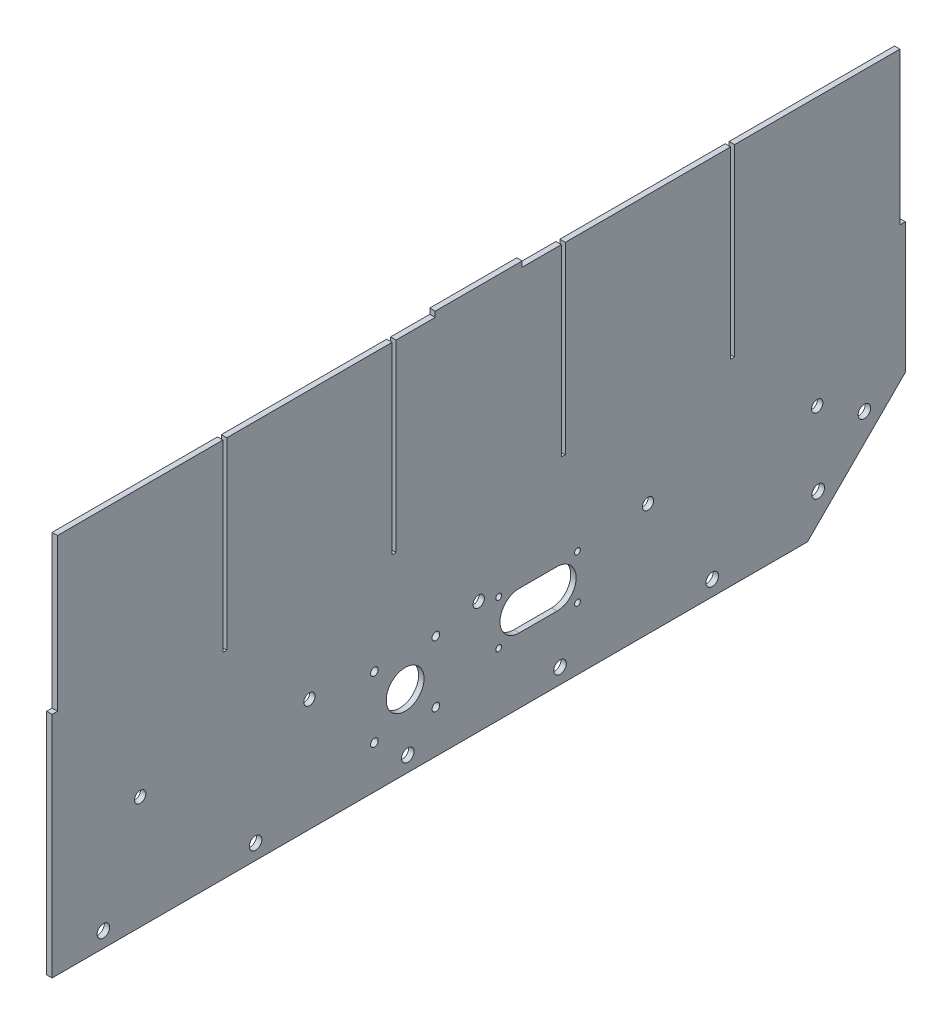
from build123d import *

# Parameters (mm, degrees)
SKETCH1_W            = 498.348
SKETCH1_H            = 165.1
BOSS_EXTRUDE1_DEPTH  = 1.5875
BOSS_EXTRUDE2_DEPTH  = 3.175
SKETCH3_R            = 3.675
CUT_EXTRUDE1_DEPTH   = 286.681383539
LPATTERN1_COUNT      = 5
LPATTERN1_PITCH      = 88.9
SKETCH4_R            = 3.675
CUT_EXTRUDE2_DEPTH   = 286.681383539
LPATTERN2_COUNT      = 2
LPATTERN2_PITCH      = 38.1
SKETCH5_W            = 3.175
SKETCH5_H            = 88.9
CUT_EXTRUDE3_DEPTH   = 286.681383539
SKETCH6_W            = 2.286
SKETCH6_H            = 107.442
CUT_EXTRUDE4_DEPTH   = 286.681383539
LPATTERN3_COUNT      = 4
LPATTERN3_PITCH      = 98.8568
SKETCH8_W            = 50.8
SKETCH8_H            = 3.175
BOSS_EXTRUDE3_DEPTH  = 3.175
SKETCH9_R            = 11.05
CUT_EXTRUDE5_DEPTH   = 286.681383539
M6_CLEARANCE_HOLE1_D = 6.6
LPATTERN4_COUNT      = 3
LPATTERN4_PITCH      = 98.8568
LPATTERN4_COUNT_DIR2 = 3
LPATTERN4_PITCH_DIR2 = 98.8568
M3_CLEARANCE_HOLE1_D = 3.4
M4_CLEARANCE_HOLE1_D = 4.5
CUT_EXTRUDE6_DEPTH   = 286.681383539


with BuildPart() as part:
    # Sketch1 → Boss-Extrude1 (new, symmetric)
    with BuildSketch(Plane(origin=(0, 0, 0), x_dir=(0, 0, -1), z_dir=(1, 0, 0))):
        Rectangle(SKETCH1_W, SKETCH1_H)
    extrude(amount=BOSS_EXTRUDE1_DEPTH, both=True)

    # Sketch2 → Boss-Extrude2 (add)
    with BuildSketch(Plane(origin=(1.5875, 0, 0), x_dir=(0, 0, -1), z_dir=(1, 0, 0))):
        Polygon((192.024, -139.7), (249.174, -82.55), (-249.174, -82.55), (-249.174, -139.7), align=None)
    extrude(amount=-BOSS_EXTRUDE2_DEPTH)

    # Sketch3 → Cut-Extrude1 (cut, through all)
    with BuildSketch(Plane.ZY.offset(1.5875)):
        with Locations((219.202, -130.81)):
            Circle(SKETCH3_R)
    cut_extrude1 = extrude(amount=-CUT_EXTRUDE1_DEPTH, mode=Mode.SUBTRACT)

    # LPattern1: Cut-Extrude1 ×5
    with Locations(*[(0, 0, -i * LPATTERN1_PITCH) for i in range(1, LPATTERN1_COUNT)]):
        add(cut_extrude1, mode=Mode.SUBTRACT)

    # Sketch4 → Cut-Extrude2 (cut, symmetric)
    with BuildSketch(Plane.ZY.offset(1.5875)):
        with Locations((-198.310179285, -117.249359697)):
            Circle(SKETCH4_R)
    cut_extrude2 = extrude(amount=CUT_EXTRUDE2_DEPTH, both=True, mode=Mode.SUBTRACT)

    # LPattern2: Cut-Extrude2 ×2
    with Locations(*[Vector(0, 0.7071067811865439, -0.7071067811865512) * (i * LPATTERN2_PITCH) for i in range(1, LPATTERN2_COUNT)]):
        add(cut_extrude2, mode=Mode.SUBTRACT)

    # Sketch5 → Cut-Extrude3 (cut, through all)
    with BuildSketch(Plane(origin=(1.5875, 0, 0), x_dir=(0, 0, -1), z_dir=(1, 0, 0))):
        with Locations((247.5865, 38.1)):
            Rectangle(SKETCH5_W, SKETCH5_H)
        with Locations((-247.5865, 38.1)):
            Rectangle(SKETCH5_W, SKETCH5_H)
    extrude(amount=-CUT_EXTRUDE3_DEPTH, mode=Mode.SUBTRACT)

    # Sketch6 → Cut-Extrude4 (cut, through all)
    with BuildSketch(Plane(origin=(1.5875, 0, 0), x_dir=(0, 0, -1), z_dir=(1, 0, 0))):
        with Locations((148.2852, 28.829)):
            Rectangle(SKETCH6_W, SKETCH6_H)
    cut_extrude4 = extrude(amount=-CUT_EXTRUDE4_DEPTH, mode=Mode.SUBTRACT)

    # LPattern3: Cut-Extrude4 ×4
    with Locations(*[(0, 0, i * LPATTERN3_PITCH) for i in range(1, LPATTERN3_COUNT)]):
        add(cut_extrude4, mode=Mode.SUBTRACT)

    # Sketch8 → Boss-Extrude3 (add)
    with BuildSketch(Plane(origin=(1.5875, 0, 0), x_dir=(0, 0, -1), z_dir=(1, 0, 0))):
        with Locations((0, 84.1375)):
            Rectangle(SKETCH8_W, SKETCH8_H)
    extrude(amount=-BOSS_EXTRUDE3_DEPTH)

    # Sketch9 → Cut-Extrude5 (cut, through all)
    with BuildSketch(Plane(origin=(1.5875, 0, 0), x_dir=(0, 0, -1), z_dir=(1, 0, 0))):
        with Locations((-42.9768, -96.7994)):
            Circle(SKETCH9_R)
    extrude(amount=-CUT_EXTRUDE5_DEPTH, mode=Mode.SUBTRACT)

    # M6 Clearance Hole1 (through all)
    with Locations(Plane(origin=(1.5875, 0, 0), x_dir=(0, 0, -1), z_dir=(1, 0, 0))):
        with Locations((0, -73.8124)):
            m6_clearance_hole1 = Hole(M6_CLEARANCE_HOLE1_D / 2)

    # LPattern4: M6 Clearance Hole1 3 × 3
    with Locations(*[Vector(0, 0, 1) * (i * LPATTERN4_PITCH) + Vector(0, 0, -1) * (j * LPATTERN4_PITCH_DIR2) for i in range(LPATTERN4_COUNT) for j in range(LPATTERN4_COUNT_DIR2) if (i, j) != (0, 0)]):
        add(m6_clearance_hole1, mode=Mode.SUBTRACT)

    # M3 Clearance Hole1 (through all)
    with Locations(Plane(origin=(1.5875, 0, 0), x_dir=(0, 0, -1), z_dir=(1, 0, 0))):
        with Locations((11.674, -77.315), (11.674, -103.315), (57.674, -103.315), (57.674, -77.315)):
            Hole(M3_CLEARANCE_HOLE1_D / 2)

    # M4 Clearance Hole1 (through all)
    with Locations(Plane(origin=(1.5875, 0, 0), x_dir=(0, 0, -1), z_dir=(1, 0, 0))):
        with Locations((-25.0163, -78.8389), (-60.9373, -78.8389), (-60.9373, -114.7599), (-25.0163, -114.7599)):
            Hole(M4_CLEARANCE_HOLE1_D / 2)

    # Sketch14 → Cut-Extrude6 (cut, through all)
    with BuildSketch(Plane(origin=(1.5875, 0, 0), x_dir=(0, 0, -1), z_dir=(1, 0, 0))):
        with BuildLine():
            Line((23.674, -101.565), (45.674, -101.565))
            ThreePointArc((45.674, -101.565), (56.924, -90.315), (45.674, -79.065))
            Line((45.674, -79.065), (23.674, -79.065))
            ThreePointArc((23.674, -79.065), (12.424, -90.315), (23.674, -101.565))
        make_face()
    extrude(amount=-CUT_EXTRUDE6_DEPTH, mode=Mode.SUBTRACT)


solid = part.part
